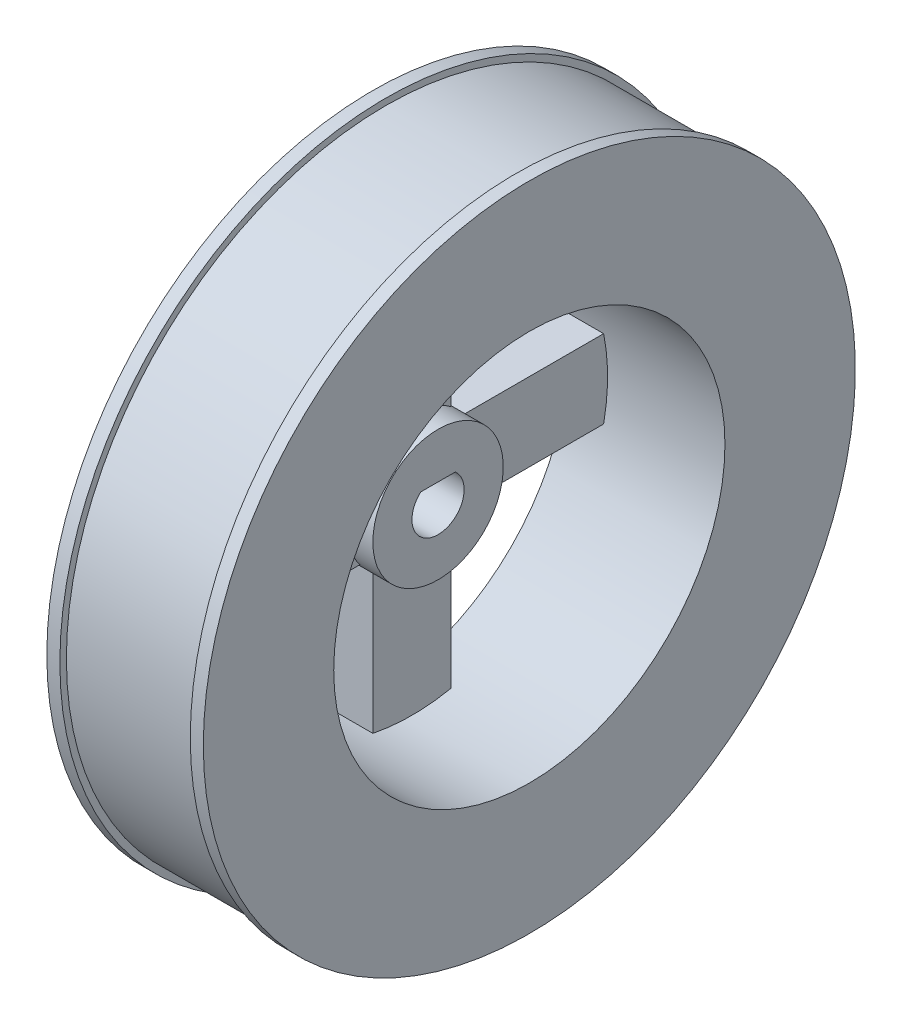
from build123d import *

# Parameters (mm, degrees)
SKETCH1_W               = 5
SKETCH1_H               = 5
BOSS_EXTRUDE1_DEPTH     = 3
CUT_EXTRUDE1_DEPTH      = 37.041642582
CUT_EXTRUDE1_DEPTH_BACK = 37.041642582
CIRPATTERN1_COUNT       = 4


with BuildPart() as part:
    # Sketch1 → Revolve1 (revolve)
    with BuildSketch(Plane.XY):
        Polygon((-6, 25), (-6, 15), (6, 15), (6, 25), (5, 25), (5, 24.5), (-5, 24.5), (-5, 25), align=None)
        with Locations((-3.5, 2.5)):
            Rectangle(SKETCH1_W, SKETCH1_H)
    revolve(axis=Axis((0, 0, 0), (1, 0, 0)))

    # Sketch2 → Boss-Extrude1 (add)
    with BuildSketch(Plane(origin=(-6, 0, 0), x_dir=(0, 0, -1), z_dir=(1, 0, 0))):
        with BuildLine():
            Line((-3, 4), (-3, 14.696938457))
            ThreePointArc((-3, 14.696938457), (0, 15), (3, 14.696938457))
            Line((3, 14.696938457), (3, 4))
            ThreePointArc((3, 4), (0, 5), (-3, 4))
        make_face()
    boss_extrude1 = extrude(amount=BOSS_EXTRUDE1_DEPTH)

    # Sketch3 → Cut-Extrude1 (cut, two sides: drawn at the far end of the back side and taken through both)
    with BuildSketch(Plane(origin=(-1, 0, 0), x_dir=(0, 0, -1), z_dir=(1, 0, 0)).offset(-CUT_EXTRUDE1_DEPTH_BACK)):
        with BuildLine():
            Line((-1.322875656, 1.5), (1.322875656, 1.5))
            ThreePointArc((1.322875656, 1.5), (0, -2), (-1.322875656, 1.5))
        make_face()
    extrude(amount=CUT_EXTRUDE1_DEPTH + CUT_EXTRUDE1_DEPTH_BACK, mode=Mode.SUBTRACT)

    # CirPattern1: Boss-Extrude1 ×4 about axis
    cirpattern1_axis = Axis((-6, 0, 0), (1, 0, 0))
    for i in range(1, CIRPATTERN1_COUNT):
        add(boss_extrude1.rotate(cirpattern1_axis, i * 360 / CIRPATTERN1_COUNT))


solid = part.part
